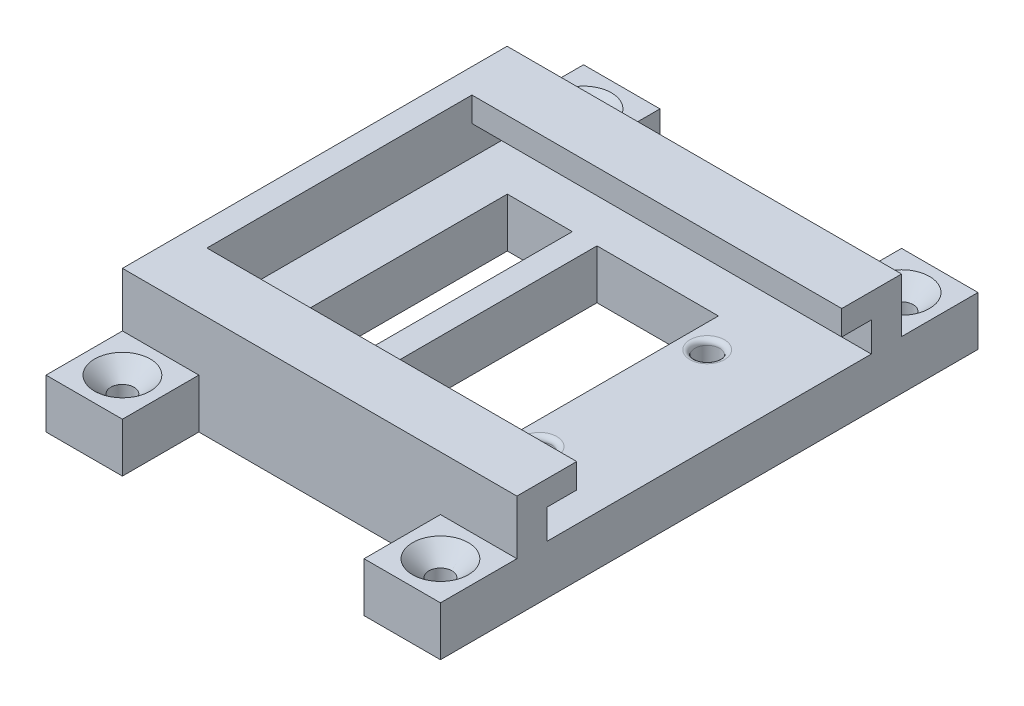
from build123d import *

# Parameters (mm, degrees)
BOSS_EXTRUDE1_DEPTH     = 75
SKETCH2_W               = 78.014759722
SKETCH2_H               = 21
BOSS_EXTRUDE2_DEPTH     = 5
SKETCH9_W               = 15.5
SKETCH9_H               = 10
BOSS_EXTRUDE3_DEPTH     = 15.5
SKETCH10_W              = 15.5
SKETCH10_H              = 10
BOSS_EXTRUDE4_DEPTH     = 15.5
CUT_EXTRUDE6_DEPTH      = 116.679212956
CUT_EXTRUDE6_DEPTH_BACK = 116.679212956
SKETCH11_R              = 2.35
FILLET2_SIZE            = 3.3
FILLET3_SIZE            = 3.3
CUT_EXTRUDE1_DEPTH      = 116.679212956
CUT_EXTRUDE1_DEPTH_BACK = 116.679212956
SKETCH3_R               = 2.5
FILLET1_R               = 1
CUT_EXTRUDE5_DEPTH      = 25


with BuildPart() as part:
    # Sketch1 → Boss-Extrude1 (new body)
    with BuildSketch(Plane(origin=(0, 0, 0), x_dir=(0, 0, -1), z_dir=(1, 0, 0))):
        Polygon((65.75, 0), (0, 0), (0, 4.94109675), (0, 6), (6, 6), (6, 11), (-3.632379861, 11), (-6.132379861, 11), (-6.132379861, -5.462885823), (-6.132379861, -10), (71.882379861, -10), (71.882379861, -5.462885823), (71.882379861, 11), (69.382379861, 11), (59.75, 11), (59.75, 6), (65.75, 6), align=None)
    extrude(amount=BOSS_EXTRUDE1_DEPTH)

    # Sketch2 → Boss-Extrude2 (add)
    with BuildSketch(Plane.ZY):
        with Locations((-32.875, 0.5)):
            Rectangle(SKETCH2_W, SKETCH2_H)
    extrude(amount=BOSS_EXTRUDE2_DEPTH)

    # Sketch9 → Boss-Extrude3 (add)
    with BuildSketch(Plane.XY.offset(6.132379861)):
        with Locations((2.75, -5)):
            Rectangle(SKETCH9_W, SKETCH9_H)
        with Locations((67.25, -5)):
            Rectangle(SKETCH9_W, SKETCH9_H)
    extrude(amount=BOSS_EXTRUDE3_DEPTH)

    # Sketch10 → Boss-Extrude4 (add)
    with BuildSketch(Plane(origin=(0, 0, -71.882379861), x_dir=(-1, 0, 0), z_dir=(0, 0, -1))):
        with Locations((-67.25, -5)):
            Rectangle(SKETCH10_W, SKETCH10_H)
        with Locations((-2.75, -5)):
            Rectangle(SKETCH10_W, SKETCH10_H)
    extrude(amount=BOSS_EXTRUDE4_DEPTH)

    # Sketch11 → Cut-Extrude6 (cut, two sides: drawn at the far end of the back side and taken through both)
    with BuildSketch(Plane(origin=(0, 0, 0), x_dir=(1, 0, 0), z_dir=(0, 1, 0)).offset(-CUT_EXTRUDE6_DEPTH_BACK)):
        with Locations(Location((2.75, -13.882379861, 0), (0, 0, 270))):
            Circle(SKETCH11_R)
        with Locations(Location((67.25, -13.882379861, 0), (0, 0, 90))):
            Circle(SKETCH11_R)
        with Locations(Location((67.25, 79.632379861, 0), (0, 0, 270))):
            Circle(SKETCH11_R)
        with Locations(Location((2.75, 79.632379861, 0), (0, 0, 90))):
            Circle(SKETCH11_R)
    extrude(amount=CUT_EXTRUDE6_DEPTH + CUT_EXTRUDE6_DEPTH_BACK, mode=Mode.SUBTRACT)

    # Fillet2
    # a fillet whose section is not a circle: 3.3 mm, written as the material it takes off along each edge
    with BuildSketch(Plane(origin=(2.75, 0, 13.882379861), x_dir=(0, 0, 1), z_dir=(-1, 0, 0))) as fillet2_piece_1:
        with BuildLine():
            Bezier((2.35, -FILLET2_SIZE), (2.35, 0), (2.35 + FILLET2_SIZE, 0), weights=[1, 0.016667517, 1])
            Line((2.35 + FILLET2_SIZE, 0), (2.35, 0))
            Line((2.35, 0), (2.35, -FILLET2_SIZE))
        make_face()
    revolve(axis=Axis((2.75, 0, 13.882379861), (0, 1, 0)), mode=Mode.SUBTRACT)

    # Fillet3
    # a fillet whose section is not a circle: 3.3 mm, written as the material it takes off along each edge
    with BuildSketch(Plane(origin=(2.75, 0, -79.632379861), x_dir=(0, 0, -1), z_dir=(1, 0, 0))) as fillet3_piece_1:
        with BuildLine():
            Bezier((2.35 + FILLET3_SIZE, 0), (2.35, 0), (2.35, -FILLET3_SIZE), weights=[1, 0.016667517, 1])
            Line((2.35, -FILLET3_SIZE), (2.35, 0))
            Line((2.35, 0), (2.35 + FILLET3_SIZE, 0))
        make_face()
    revolve(axis=Axis((2.75, 0, -79.632379861), (0, 1, 0)), mode=Mode.SUBTRACT)
    with BuildSketch(Plane(origin=(67.25, 0, -79.632379861), x_dir=(0, 0, 1), z_dir=(-1, 0, 0))) as fillet3_piece_2:
        with BuildLine():
            Bezier((2.35 + FILLET3_SIZE, 0), (2.35, 0), (2.35, -FILLET3_SIZE), weights=[1, 0.016667517, 1])
            Line((2.35, -FILLET3_SIZE), (2.35, 0))
            Line((2.35, 0), (2.35 + FILLET3_SIZE, 0))
        make_face()
    revolve(axis=Axis((67.25, 0, -79.632379861), (0, 1, 0)), mode=Mode.SUBTRACT)
    with BuildSketch(Plane(origin=(67.25, 0, 13.882379861), x_dir=(0, 0, -1), z_dir=(1, 0, 0))) as fillet3_piece_3:
        with BuildLine():
            Bezier((2.35 + FILLET3_SIZE, 0), (2.35, 0), (2.35, -FILLET3_SIZE), weights=[1, 0.016667517, 1])
            Line((2.35, -FILLET3_SIZE), (2.35, 0))
            Line((2.35, 0), (2.35 + FILLET3_SIZE, 0))
        make_face()
    revolve(axis=Axis((67.25, 0, 13.882379861), (0, 1, 0)), mode=Mode.SUBTRACT)

    # Sketch3 → Cut-Extrude1 (cut, two sides: drawn at the far end of the back side and taken through both)
    with BuildSketch(Plane(origin=(0, 0, 0), x_dir=(1, 0, 0), z_dir=(0, 1, 0)).offset(-CUT_EXTRUDE1_DEPTH_BACK)):
        with Locations(Location((57.59, 15.875, 0), (0, 0, 270))):
            Circle(SKETCH3_R)
        with Locations(Location((57.59, 49.875, 0), (0, 0, 270))):
            Circle(SKETCH3_R)
    extrude(amount=CUT_EXTRUDE1_DEPTH + CUT_EXTRUDE1_DEPTH_BACK, mode=Mode.SUBTRACT)

    # Fillet1
    fillet1_edges = [part.edges().sort_by_distance(p)[0] for p in [
        (57.59, 0, -18.375),
        (57.59, 0, -52.375),
    ]]
    fillet(fillet1_edges, radius=FILLET1_R)

    # Sketch7 → Cut-Extrude5 (cut)
    with BuildSketch(Plane(origin=(0, 0, 0), x_dir=(1, 0, 0), z_dir=(0, 1, 0))):
        Polygon((45.171917579, 56.935980992), (28.171917579, 56.935980992), (28.171917579, 9.564019008), (52.795681386, 9.564019008), (52.795681386, 56.935980992), align=None)
        Polygon((9.992962264, 33.250106903), (9.992962264, 9.564019008), (23.171917579, 9.564019008), (23.171917579, 33.25), (23.171917579, 56.935980992), (9.992962264, 56.935980992), align=None)
    extrude(amount=-CUT_EXTRUDE5_DEPTH, mode=Mode.SUBTRACT)


solid = part.part
